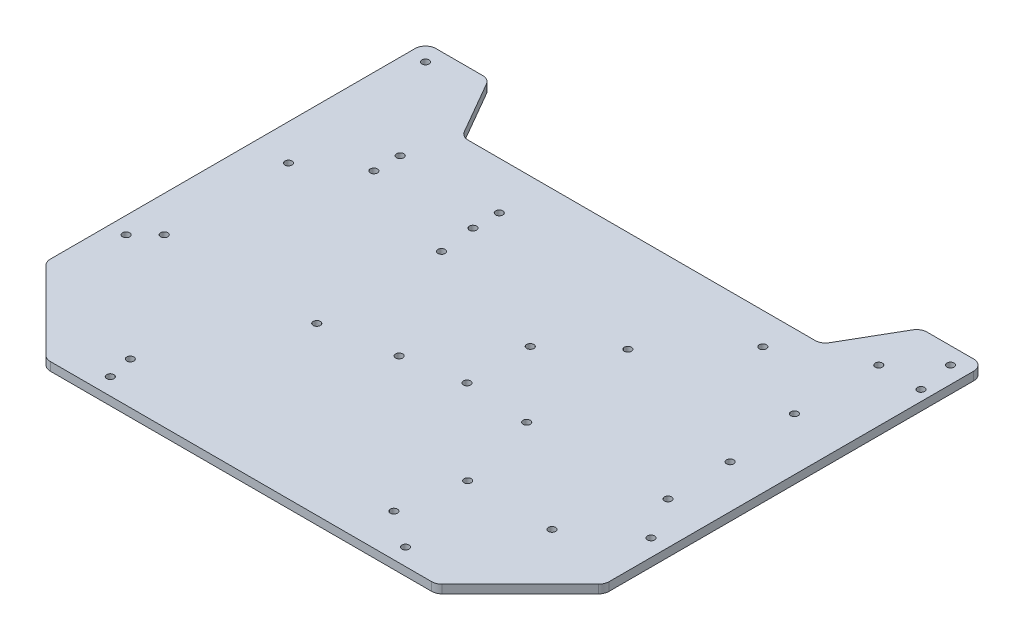
from build123d import *

# Parameters (mm, degrees)
MAIN_EXTRUSION_DEPTH    = 4
CONG_1_R                = 5
ESQUISSE1_R             = 1
ENL_V_MAT_EXTRU_1_DEPTH = 257.850637531
D_GAGEMENT_M31_D        = 3.4
ESQUISSE4_R             = 1
ENL_V_MAT_EXTRU_2_DEPTH = 257.850637531
D_GAGEMENT_M32_D        = 3.4


with BuildPart() as part:
    # Main scetch → Main extrusion (new body)
    with BuildSketch(Plane(origin=(0, 0, 0), x_dir=(1, 0, 0), z_dir=(0, 1, 0))):
        Polygon((-92.5, 0), (92.5, 0), (132.5, 40), (132.5, 220), (102.5, 220), (85.179491924, 190), (-85.179491924, 190), (-102.5, 220), (-132.5, 220), (-132.5, 40), align=None)
    extrude(amount=MAIN_EXTRUSION_DEPTH)

    # Congé1
    cong_1_edges = [part.edges().sort_by_distance(p)[0] for p in [
        (-132.5, 2, -40),
        (-92.5, 2, 0),
        (92.5, 2, 0),
        (132.5, 2, -40),
        (132.5, 2, -220),
        (102.5, 2, -220),
        (85.179491924, 2, -190),
        (-85.179491924, 2, -190),
        (-102.5, 2, -220),
        (-132.5, 2, -220),
    ]]
    fillet(cong_1_edges, radius=CONG_1_R)

    # Esquisse1 → Enlèv. mat.-Extru.1 (cut, through all)
    with BuildSketch(Plane(origin=(0, 4, 0), x_dir=(1, 0, 0), z_dir=(0, 1, 0))):
        with Locations((70, 8)):
            Circle(ESQUISSE1_R)
        with Locations((124.5, 70)):
            Circle(ESQUISSE1_R)
        with Locations((124.5, 212)):
            Circle(ESQUISSE1_R)
        with Locations((-124.5, 212)):
            Circle(ESQUISSE1_R)
        with Locations((-124.5, 70)):
            Circle(ESQUISSE1_R)
        with Locations((-70, 8)):
            Circle(ESQUISSE1_R)
    extrude(amount=-ENL_V_MAT_EXTRU_1_DEPTH, mode=Mode.SUBTRACT)

    # Dégagement M31 (through all)
    with Locations(Plane(origin=(0, 4, 0), x_dir=(1, 0, 0), z_dir=(0, 1, 0))):
        with Locations((-124.5, 212), (-124.5, 70), (-70, 8), (70, 8), (124.5, 70), (124.5, 212)):
            Hole(D_GAGEMENT_M31_D / 2)

    # Esquisse4 → Enlèv. mat.-Extru.2 (cut, through all)
    with BuildSketch(Plane(origin=(0, 4, 0), x_dir=(1, 0, 0), z_dir=(0, 1, 0))):
        with Locations((72.5, 175)):
            Circle(ESQUISSE4_R)
        with Locations((41.5, 142)):
            Circle(ESQUISSE4_R)
        with Locations((107.5, 155)):
            Circle(ESQUISSE4_R)
        with Locations((127.5, 195)):
            Circle(ESQUISSE4_R)
        with Locations((112, 120)):
            Circle(ESQUISSE4_R)
        with Locations((112.5, 90)):
            Circle(ESQUISSE4_R)
        with Locations((17.2, 120)):
            Circle(ESQUISSE4_R)
        with Locations((17.2, 90)):
            Circle(ESQUISSE4_R)
        with Locations((47.5, 88)):
            Circle(ESQUISSE4_R)
        with Locations((57.5, 50)):
            Circle(ESQUISSE4_R)
        with Locations((97.5, 50)):
            Circle(ESQUISSE4_R)
        with Locations((52.5, 20)):
            Circle(ESQUISSE4_R)
        with Locations((-10, 85)):
            Circle(ESQUISSE4_R)
        with Locations((-72.5, 20)):
            Circle(ESQUISSE4_R)
        with Locations((107.5, 195)):
            Circle(ESQUISSE4_R)
        with Locations((-115.5, 138)):
            Circle(ESQUISSE4_R)
        with Locations((-42.86, 138)):
            Circle(ESQUISSE4_R)
        with Locations((-115.5, 79.07)):
            Circle(ESQUISSE4_R)
        with Locations((-42.890430383, 78.82)):
            Circle(ESQUISSE4_R)
        with Locations((-92, 167.5)):
            Circle(ESQUISSE4_R)
        with Locations((-45, 167.5)):
            Circle(ESQUISSE4_R)
        with Locations((-92, 155)):
            Circle(ESQUISSE4_R)
        with Locations((-45, 155)):
            Circle(ESQUISSE4_R)
    extrude(amount=-ENL_V_MAT_EXTRU_2_DEPTH, mode=Mode.SUBTRACT)

    # Dégagement M32 (through all)
    with Locations(Plane(origin=(0, 4, 0), x_dir=(1, 0, 0), z_dir=(0, 1, 0))):
        with Locations((17.2, 120), (41.5, 142), (72.5, 175), (107.5, 155), (127.5, 195), (112, 120), (112.5, 90), (47.5, 88), (17.2, 90), (57.5, 50), (97.5, 50), (-10, 85), (-72.5, 20), (52.5, 20), (107.5, 195), (-115.5, 138), (-42.86, 138), (-115.5, 79.07), (-42.890430383, 78.82), (-92, 167.5), (-92, 155), (-45, 155), (-45, 167.5)):
            Hole(D_GAGEMENT_M32_D / 2)


solid = part.part
